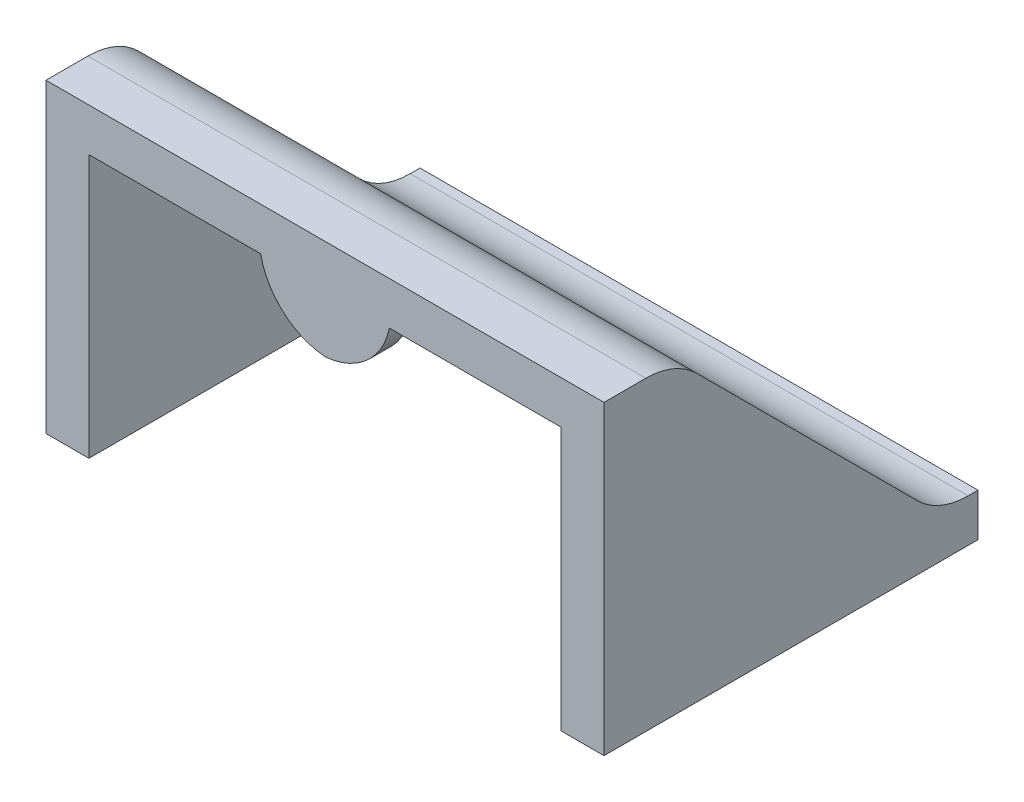
from build123d import *

# Parameters (mm, degrees)
SKETCH_1_W          = 25
SKETCH_1_H          = 10
EXTRUDE_1_DEPTH     = 3
EXTRUDE_3_DEPTH     = 7
EXTRUDE_4_DEPTH     = 39
EXTRUDE_6_DEPTH     = 3
EXTRUDE_7_DEPTH     = 3
SKETCH_10_W         = 25
SKETCH_10_H         = 10
CUT_EXTRUDE_1_DEPTH = 3
FILLET_1_R          = 5
FILLET_2_R          = 5
SKETCH_12_W         = 9
SKETCH_12_H         = 1.5
EXTRUDE_9_DEPTH     = 4
FILLET_3_R          = 5


with BuildPart() as part:
    # 草图1 → 凸台-拉伸1 (new body)
    with BuildSketch(Plane.XY):
        with Locations((12.5, -5)):
            Rectangle(SKETCH_1_W, SKETCH_1_H)
    extrude(amount=EXTRUDE_1_DEPTH)

    # 草图5 → 凸台-拉伸3 (add)
    with BuildSketch(Plane.XY.offset(3)):
        Polygon((25, 0), (-2, 0), (-8, 0), (-8, -3), (0, -3), (27.572478777, -3), (31, -3), (31, 0), align=None)
    extrude(amount=EXTRUDE_3_DEPTH)

    # 草图6 → 凸台-拉伸4 (add)
    with BuildSketch(Plane(origin=(31, 0, 0), x_dir=(0, 0, -1), z_dir=(1, 0, 0))):
        Polygon((-10, 0), (-25.384776311, 15.384776311), (-29.142135624, 15.384776311), (-29.142135624, 18.384776311), (-24.142135624, 18.384776311), (-5.757359313, 0), align=None)
    extrude(amount=-EXTRUDE_4_DEPTH)

    # 草图8 → 凸台-拉伸6 (add)
    with BuildSketch(Plane(origin=(31, 0, 0), x_dir=(0, 0, -1), z_dir=(1, 0, 0))):
        Polygon((-29.142135624, 15.384776311), (-25.384776311, 15.384776311), (-10, 0), (-10, -3), (-29.142135624, -3), align=None)
    extrude(amount=-EXTRUDE_6_DEPTH)

    # 草图9 → 凸台-拉伸7 (add)
    with BuildSketch(Plane.ZY.offset(8)):
        Polygon((29.142135624, 15.384776311), (25.384776311, 15.384776311), (10, 0), (10, -3), (29.142135624, -3), align=None)
    extrude(amount=-EXTRUDE_7_DEPTH)

    # 草图10 → 切除-拉伸1 (cut)
    with BuildSketch(Plane(origin=(0, 0, 0), x_dir=(-1, 0, 0), z_dir=(0, 0, -1))):
        with Locations((-12.5, -5)):
            Rectangle(SKETCH_10_W, SKETCH_10_H)
    extrude(amount=-CUT_EXTRUDE_1_DEPTH, mode=Mode.SUBTRACT)

    # 圆角1
    fillet_1_edges = [part.edges().sort_by_distance(p)[0] for p in [
        (11.5, 18.384776311, 24.142135624),
    ]]
    fillet(fillet_1_edges, radius=FILLET_1_R)

    # 圆角2
    fillet_2_edges = [part.edges().sort_by_distance(p)[0] for p in [
        (11.5, 0, 5.757359313),
    ]]
    fillet(fillet_2_edges, radius=FILLET_2_R)

    # 草图12 → 凸台-拉伸9 (add)
    with BuildSketch(Plane(origin=(0, 15.384776311, 0), x_dir=(-1, 0, 0), z_dir=(0, -1, 0))):
        with Locations((-11.5, -28.392135624)):
            Rectangle(SKETCH_12_W, SKETCH_12_H)
    extrude(amount=EXTRUDE_9_DEPTH)

    # 圆角3
    # the kernel refuses this fillet: 5 mm, written as the material it takes off along each edge
    with BuildSketch(Plane(origin=(16, 11.384776311, 41.389584338), x_dir=(-1.590727549682408e-12, 1.0, 0), z_dir=(0, 0, -1))) as fillet_3_piece_1_section:
        with BuildLine():
            CenterArc((5, -4.898979486), FILLET_3_R, 101.536959033, 78.463040967)
            Line((0, -4.898979486), (0, 0))
            Line((0, 0), (4, 0))
        make_face()
    fillet_3_piece_1 = extrude(amount=25.994897428, mode=Mode.PRIVATE)
    fillet_3_piece_1 = split(fillet_3_piece_1, bisect_by=Plane(origin=(14.26962273, 15.448091311, 25.448091311), z_dir=(0, -0.7071067811865475, 0.7071067811865476)), keep=Keep.TOP, mode=Mode.PRIVATE)
    add(fillet_3_piece_1, mode=Mode.SUBTRACT)
    with BuildSketch(Plane(origin=(7, 11.384776311, 15.39468691), x_dir=(1.5905055050774829e-12, 1.0, 0), z_dir=(0, 0, 1))) as fillet_3_piece_2_section:
        with BuildLine():
            CenterArc((5, -4.898979486), FILLET_3_R, 101.536959033, 78.463040967)
            Line((0, -4.898979486), (0, 0))
            Line((0, 0), (4, 0))
        make_face()
    fillet_3_piece_2 = extrude(amount=25.994897428, mode=Mode.PRIVATE)
    fillet_3_piece_2 = split(fillet_3_piece_2, bisect_by=Plane(origin=(8.73037727, 15.448091311, 25.448091311), z_dir=(0, -0.7071067811865475, 0.7071067811865476)), keep=Keep.TOP, mode=Mode.PRIVATE)
    add(fillet_3_piece_2, mode=Mode.SUBTRACT)


solid = part.part
